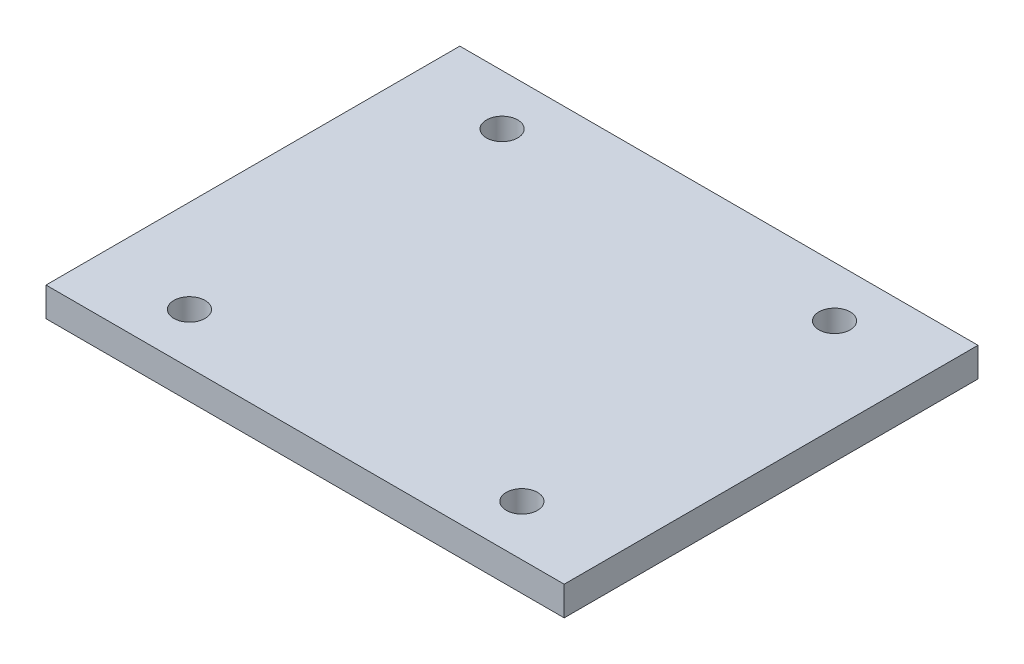
from build123d import *

# Parameters (mm, degrees)
SKETCH2_W            = 112.7
SKETCH2_H            = 90
BOSS_EXTRUDE1_DEPTH  = 6.35
SKETCH3_R            = 3.4
MOUNTING_HOLES_DEPTH = 145.366244323


with BuildPart() as part:
    # Sketch2 → Boss-Extrude1 (new body)
    with BuildSketch(Plane(origin=(0, 0, 0), x_dir=(1, 0, 0), z_dir=(0, 1, 0))):
        with Locations((56.35, 45)):
            Rectangle(SKETCH2_W, SKETCH2_H)
    extrude(amount=BOSS_EXTRUDE1_DEPTH)

    # Sketch3 → Mounting Holes (cut, through all)
    with BuildSketch(Plane(origin=(0, 6.35, 0), x_dir=(1, 0, 0), z_dir=(0, 1, 0))):
        with Locations((20.2, 79)):
            Circle(SKETCH3_R)
        with Locations((20.2, 11)):
            Circle(SKETCH3_R)
        with Locations((92.5, 11)):
            Circle(SKETCH3_R)
        with Locations((92.5, 79)):
            Circle(SKETCH3_R)
    extrude(amount=-MOUNTING_HOLES_DEPTH, mode=Mode.SUBTRACT)


solid = part.part
